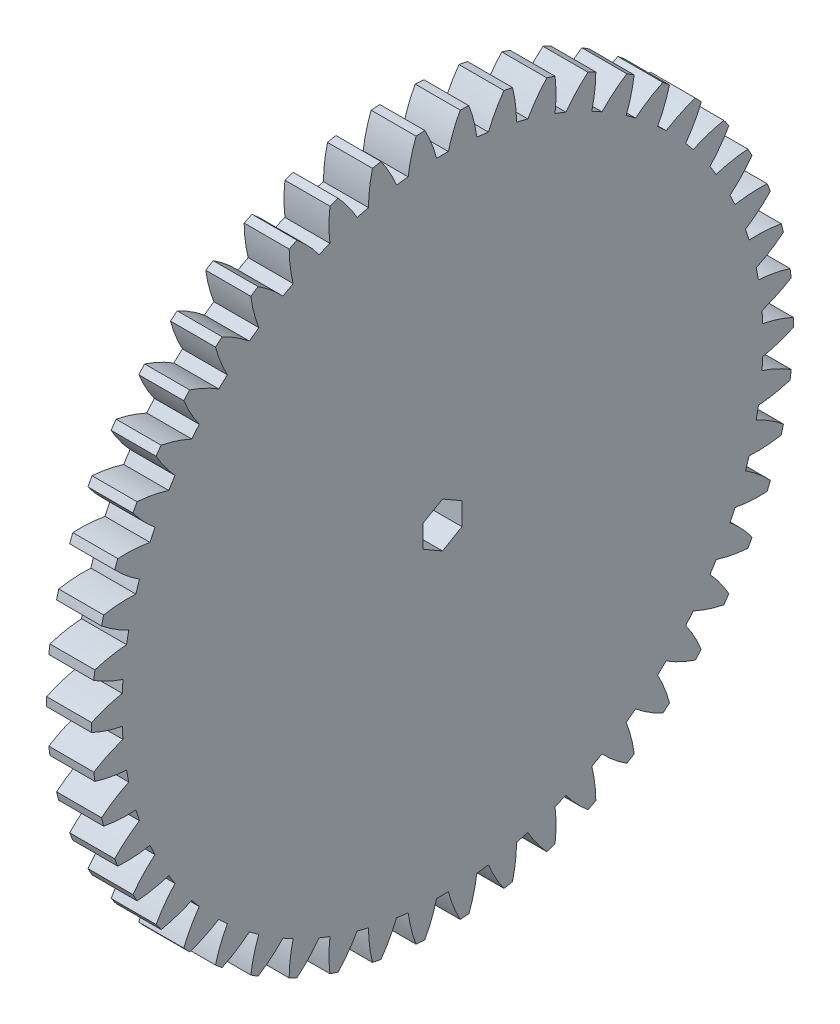
from build123d import *

# Parameters (mm, degrees)
BASPROSKE_W         = 5
BASPROSKE_H         = 39
TOOTHCUT_DEPTH      = 56.380501984
TEETHCUTS_COUNT     = 50
TEETHCUTS_ANGLE     = 352.8
BORE_DEPTH          = 50.0000508
BOSS_EXTRUDE1_DEPTH = 6


with BuildPart() as part:
    # BasProSke → Base-Revolve (revolve)
    with BuildSketch(Plane(origin=(0, 0, 0), x_dir=(1, 0, 0), z_dir=(0, 1, 0))):
        with Locations((2.5, 19.5)):
            Rectangle(BASPROSKE_W, BASPROSKE_H)
    revolve(axis=Axis((-10, 0, 0), (1, 0, 0)))

    # TooCutSke → ToothCut (cut, through all)
    with BuildSketch(Plane(origin=(0, 0, 0), x_dir=(0, 0, -1), z_dir=(1, 0, 0))):
        with BuildLine():
            ThreePointArc((0.649974317, 35.618069984), (0, 35.624), (-0.649974317, 35.618069984))
            ThreePointArc((-0.649974317, 35.618069984), (-1.213667282, 37.336773563), (-1.980135572, 38.975131921))
            ThreePointArc((-1.980135572, 38.975131921), (0, 39.0254), (1.980135572, 38.975131921))
            ThreePointArc((1.980135572, 38.975131921), (1.213667282, 37.336773563), (0.649974317, 35.618069984))
        make_face()
    toothcut = extrude(amount=TOOTHCUT_DEPTH, mode=Mode.SUBTRACT)

    # TeethCuts: ToothCut ×50 about axis
    teethcuts_axis = Axis((-10, 0, 0), (1, 0, 0))
    for i in range(1, TEETHCUTS_COUNT):
        add(toothcut.rotate(teethcuts_axis, i * TEETHCUTS_ANGLE / (TEETHCUTS_COUNT - 1)), mode=Mode.SUBTRACT)

    # BorSke → Bore (cut, symmetric)
    with BuildSketch(Plane(origin=(0, 0, 0), x_dir=(0, 0, -1), z_dir=(1, 0, 0))):
        Polygon((0, -2.5), (2.165063509, -1.25), (2.165063509, 1.25), (0, 2.5), (-2.165063509, 1.25), (-2.165063509, -1.25), align=None)
    extrude(amount=BORE_DEPTH, both=True, mode=Mode.SUBTRACT)

    # Sketch1 → Boss-Extrude1 (add)
    with BuildSketch(Plane.ZY):
        with BuildLine():
            ThreePointArc((0.186825145, -8.9980607), (1.087459567, -7.388027907), (0.875696034, -5.555405697))
            ThreePointArc((0.875696034, -5.555405697), (1.737911579, -5.348741847), (2.556932571, -5.009138831))
            ThreePointArc((2.556932571, -5.009138831), (3.462800583, -6.616232824), (5.137782668, -7.389397083))
            ThreePointArc((5.137782668, -7.389397083), (5.290067274, -7.281152947), (5.440072096, -7.169770958))
            ThreePointArc((5.440072096, -7.169770958), (5.222347117, -5.337847436), (3.973838512, -3.979696405))
            ThreePointArc((3.973838512, -3.979696405), (4.549911578, -3.305704257), (5.012899835, -2.549551185))
            ThreePointArc((5.012899835, -2.549551185), (6.690388599, -3.317261679), (8.499932121, -2.958234937))
            ThreePointArc((8.499932121, -2.958234937), (8.559508648, -2.781152945), (8.615396408, -2.602872401))
            ThreePointArc((8.615396408, -2.602872401), (7.36247557, -1.248790671), (5.554109745, -0.883878352))
            ThreePointArc((5.554109745, -0.883878352), (5.624, 3e-09), (5.554109744, 0.883878357))
            ThreePointArc((5.554109744, 0.883878357), (7.362475569, 1.248790678), (8.615396405, 2.602872409))
            ThreePointArc((8.615396405, 2.602872409), (8.559508645, 2.781152953), (8.499932118, 2.958234945))
            ThreePointArc((8.499932118, 2.958234945), (6.690388596, 3.317261685), (5.012899832, 2.54955119))
            ThreePointArc((5.012899832, 2.54955119), (4.549911575, 3.305704261), (3.973838508, 3.979696409))
            ThreePointArc((3.973838508, 3.979696409), (5.222347112, 5.33784744), (5.44007209, 7.169770963))
            ThreePointArc((5.44007209, 7.169770963), (5.290067267, 7.281152952), (5.137782661, 7.389397088))
            ThreePointArc((5.137782661, 7.389397088), (3.462800577, 6.616232827), (2.556932566, 5.009138833))
            ThreePointArc((2.556932566, 5.009138833), (1.737911574, 5.348741848), (0.875696028, 5.555405698))
            ThreePointArc((0.875696028, 5.555405698), (1.08745956, 7.388027908), (0.186825137, 8.9980607))
            ThreePointArc((0.186825137, 8.9980607), (-4e-09, 9), (-0.186825145, 8.9980607))
            ThreePointArc((-0.186825145, 8.9980607), (-1.087459567, 7.388027907), (-0.875696034, 5.555405697))
            ThreePointArc((-0.875696034, 5.555405697), (-1.737911579, 5.348741847), (-2.556932571, 5.009138831))
            ThreePointArc((-2.556932571, 5.009138831), (-3.462800583, 6.616232824), (-5.137782668, 7.389397083))
            ThreePointArc((-5.137782668, 7.389397083), (-5.290067274, 7.281152947), (-5.440072096, 7.169770958))
            ThreePointArc((-5.440072096, 7.169770958), (-5.222347117, 5.337847436), (-3.973838512, 3.979696405))
            ThreePointArc((-3.973838512, 3.979696405), (-4.549911578, 3.305704257), (-5.012899835, 2.549551185))
            ThreePointArc((-5.012899835, 2.549551185), (-6.690388599, 3.317261679), (-8.499932121, 2.958234937))
            ThreePointArc((-8.499932121, 2.958234937), (-8.559508648, 2.781152945), (-8.615396408, 2.602872401))
            ThreePointArc((-8.615396408, 2.602872401), (-7.36247557, 1.248790671), (-5.554109745, 0.883878352))
            ThreePointArc((-5.554109745, 0.883878352), (-5.624, -3e-09), (-5.554109744, -0.883878357))
            ThreePointArc((-5.554109744, -0.883878357), (-7.362475569, -1.248790678), (-8.615396405, -2.602872409))
            ThreePointArc((-8.615396405, -2.602872409), (-8.559508645, -2.781152953), (-8.499932118, -2.958234945))
            ThreePointArc((-8.499932118, -2.958234945), (-6.690388596, -3.317261685), (-5.012899832, -2.54955119))
            ThreePointArc((-5.012899832, -2.54955119), (-4.549911575, -3.305704261), (-3.973838508, -3.979696409))
            ThreePointArc((-3.973838508, -3.979696409), (-5.222347112, -5.33784744), (-5.44007209, -7.169770963))
            ThreePointArc((-5.44007209, -7.169770963), (-5.290067267, -7.281152952), (-5.137782661, -7.389397088))
            ThreePointArc((-5.137782661, -7.389397088), (-3.462800577, -6.616232827), (-2.556932566, -5.009138833))
            ThreePointArc((-2.556932566, -5.009138833), (-1.737911574, -5.348741848), (-0.875696028, -5.555405698))
            ThreePointArc((-0.875696028, -5.555405698), (-1.08745956, -7.388027908), (-0.186825137, -8.9980607))
            ThreePointArc((-0.186825137, -8.9980607), (4e-09, -9), (0.186825145, -8.9980607))
        make_face()
        Polygon((2.165063509, -1.25), (2.165063509, 1.25), (0, 2.5), (-2.165063509, 1.25), (-2.165063509, -1.25), (0, -2.5), align=None, mode=Mode.SUBTRACT)
    extrude(amount=BOSS_EXTRUDE1_DEPTH)


solid = part.part
